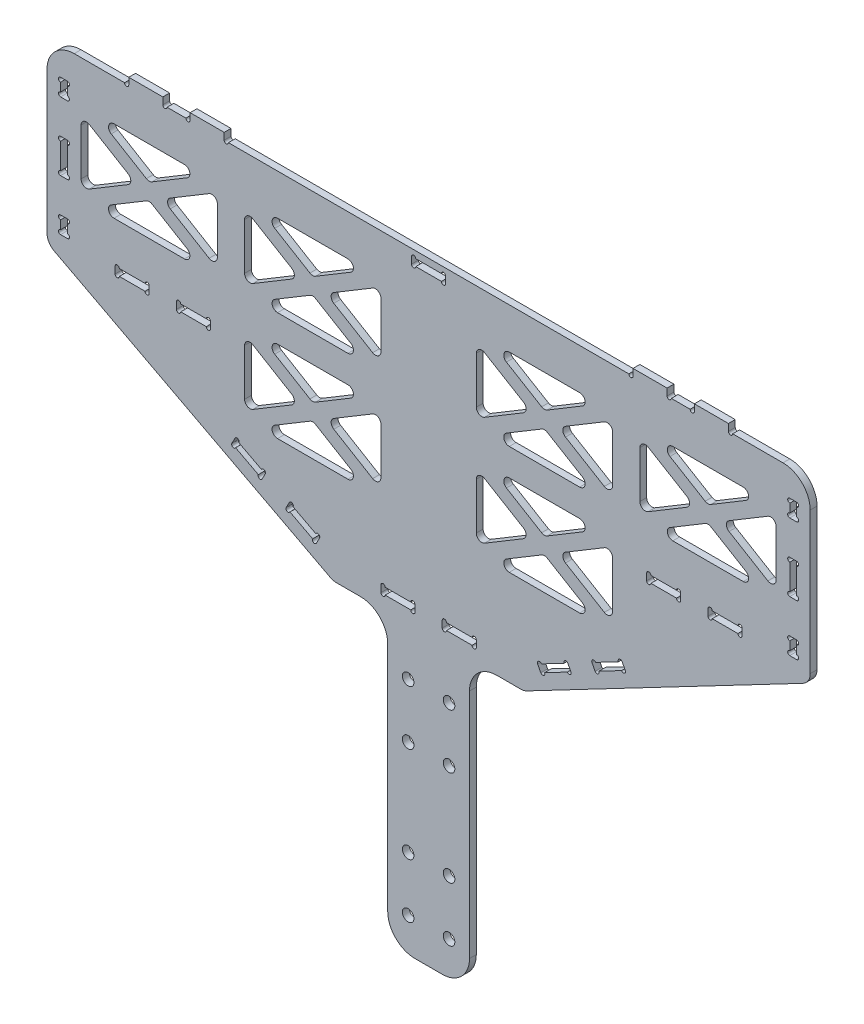
from build123d import *

# Parameters (mm, degrees)
EXTRUDE_1_DEPTH                = 5
SKETCH_2_R                     = 4.25
CUT_EXTRUDE_1_DEPTH            = 26
FILLET_1_R                     = 20
SKETCH_3_W                     = 80.881633881
SKETCH_3_H                     = 35.81900929
EXTRUDE_2_DEPTH                = 5
CUT_EXTRUDE_8_DEPTH            = 5
FILLET_3_R                     = 4
PATTERN_LINEAR_1_COUNT         = 2
PATTERN_LINEAR_1_PITCH         = 80
PATTERN_LINEAR_1_COUNT_DIR2    = 2
PATTERN_LINEAR_1_PITCH_DIR2    = 120
FILLET_3_OF_PATTERN_LINEAR_1_R = 4
MIRROR_1_DEPTH                 = 5
CUT_EXTRUDE_9_DEPTH            = 10
CUT_EXTRUDE_10_DEPTH           = 10
FILLET_4_R                     = 10
SKETCH_13_W                    = 25
SKETCH_13_H                    = 5
CUT_EXTRUDE_11_DEPTH           = 10
SKETCH_14_R                    = 1.55
CUT_EXTRUDE_12_DEPTH           = 10
SKETCH_15_W                    = 5
SKETCH_15_H                    = 12.5
SKETCH_15_H_2                  = 25
CUT_EXTRUDE_13_DEPTH           = 10
SKETCH_16_R                    = 1.55
CUT_EXTRUDE_14_DEPTH           = 10
CUT_EXTRUDE_15_DEPTH           = 10
SKETCH_18_W                    = 25
SKETCH_18_H                    = 5
EXTRUDE_3_DEPTH                = 5
SKETCH_19_R                    = 1.55
CUT_EXTRUDE_16_DEPTH           = 5


# Read off the part's stored shape, not the designer's step: 镜向1
with BuildPart() as part:
    # 草图1 → 凸台-拉伸1 (new body)
    with BuildSketch(Plane.XY):
        Polygon((-30, 0), (30, 0), (30, 210), (280, 210), (280, 450), (-280, 450), (-280, 210), (-30, 210), align=None)
    extrude(amount=EXTRUDE_1_DEPTH)

    # 草图2 → 切除-拉伸1 (cut)
    with BuildSketch(Plane.XY.offset(5)):
        with Locations((15, 25)):
            Circle(SKETCH_2_R)
        with Locations((15, 65)):
            Circle(SKETCH_2_R)
        with Locations((15, 135)):
            Circle(SKETCH_2_R)
        with Locations((15, 175)):
            Circle(SKETCH_2_R)
        with Locations(Location((-15, 175, 0), (0, 0, 180))):
            Circle(SKETCH_2_R)
        with Locations(Location((-15, 135, 0), (0, 0, 180))):
            Circle(SKETCH_2_R)
        with Locations(Location((-15, 65, 0), (0, 0, 180))):
            Circle(SKETCH_2_R)
        with Locations(Location((-15, 25, 0), (0, 0, 180))):
            Circle(SKETCH_2_R)
    extrude(amount=-CUT_EXTRUDE_1_DEPTH, mode=Mode.SUBTRACT)

    # 圆角1
    fillet_1_edges = [part.edges().sort_by_distance(p)[0] for p in [
        (30, 0, 2.5),
        (-30, 0, 2.5),
        (-30, 210, 2.5),
        (-280, 210, 2.5),
        (-280, 450, 2.5),
        (280, 450, 2.5),
        (280, 210, 2.5),
        (30, 210, 2.5),
    ]]
    fillet(fillet_1_edges, radius=FILLET_1_R)

    # 草图3 → 凸台-拉伸2 (add)
    with BuildSketch(Plane.XY.offset(5)):
        with Locations((-108.227329146, 265.055666303)):
            Rectangle(SKETCH_3_W, SKETCH_3_H)
    extrude(amount=-EXTRUDE_2_DEPTH)

    # 草图10 → 切除-拉伸8 (cut)
    with BuildSketch(Plane.XY.offset(5)):
        Polygon((-245.281746842, 420), (-164.718253158, 420), (-205, 395.830951895), align=None)
        Polygon((-255, 414.169048105), (-255, 365.830951895), (-214.718253158, 390), align=None)
        Polygon((-245.281746842, 360), (-164.718253158, 360), (-205, 384.169048105), align=None)
        Polygon((-155, 414.169048105), (-155, 365.830951895), (-195.281746842, 390), align=None)
    cut_extrude_8 = extrude(amount=-CUT_EXTRUDE_8_DEPTH, mode=Mode.SUBTRACT)

    # 圆角3
    fillet_3_edges = [part.edges().sort_by_distance(p)[0] for p in [
        (-164.718253158, 360, 2.5),
        (-205, 384.169048105, 2.5),
        (-245.281746842, 360, 2.5),
        (-255, 365.830951895, 2.5),
        (-214.718253158, 390, 2.5),
        (-255, 414.169048105, 2.5),
        (-155, 414.169048105, 2.5),
        (-195.281746842, 390, 2.5),
        (-155, 365.830951895, 2.5),
        (-164.718253158, 420, 2.5),
        (-245.281746842, 420, 2.5),
        (-205, 395.830951895, 2.5),
    ]]
    fillet(fillet_3_edges, radius=FILLET_3_R)

    # 阵列(线性)1: Cut-Extrude 8 2 × 2, 1 skipped
    with Locations(*[(j * PATTERN_LINEAR_1_PITCH_DIR2, -i * PATTERN_LINEAR_1_PITCH, 0) for i in range(PATTERN_LINEAR_1_COUNT) for j in range(PATTERN_LINEAR_1_COUNT_DIR2) if (i, j) not in ((0, 0), (1, 0))]):
        add(cut_extrude_8, mode=Mode.SUBTRACT)

    # 圆角3 of 阵列(线性)1
    fillet_3_of_pattern_linear_1_edges = [part.edges().sort_by_distance(p)[0] for p in [
        (-44.718253158, 360, 2.5),
        (-85, 384.169048105, 2.5),
        (-125.281746842, 360, 2.5),
        (-135, 365.830951895, 2.5),
        (-94.718253158, 390, 2.5),
        (-135, 414.169048105, 2.5),
        (-35, 414.169048105, 2.5),
        (-75.281746842, 390, 2.5),
        (-35, 365.830951895, 2.5),
        (-44.718253158, 420, 2.5),
        (-125.281746842, 420, 2.5),
        (-85, 395.830951895, 2.5),
        (-44.718253158, 280, 2.5),
        (-85, 304.169048105, 2.5),
        (-125.281746842, 280, 2.5),
        (-135, 285.830951895, 2.5),
        (-94.718253158, 310, 2.5),
        (-135, 334.169048105, 2.5),
        (-35, 334.169048105, 2.5),
        (-75.281746842, 310, 2.5),
        (-35, 285.830951895, 2.5),
        (-44.718253158, 340, 2.5),
        (-125.281746842, 340, 2.5),
        (-85, 315.830951895, 2.5),
    ]]
    fillet(fillet_3_of_pattern_linear_1_edges, radius=FILLET_3_OF_PATTERN_LINEAR_1_R)

    # 镜向1 outline → 镜向1 (cut)
    with BuildSketch(Plane.XY):
        with BuildLine():
            Line((59.159522351, 280), (110.840477649, 280))
            ThreePointArc((110.840477649, 280), (114.695337362, 282.932265672), (112.898460671, 287.429971703))
            Line((112.898460671, 287.429971703), (87.057983022, 302.934258292))
            ThreePointArc((87.057983022, 302.934258292), (85, 303.504286589), (82.942016978, 302.934258292))
            Line((82.942016978, 302.934258292), (57.101539329, 287.429971703))
            ThreePointArc((57.101539329, 287.429971703), (55.304662638, 282.932265672), (59.159522351, 280))
        make_face()
        with BuildLine():
            Line((110.840477649, 340), (59.159522351, 340))
            ThreePointArc((59.159522351, 340), (55.304662638, 337.067734328), (57.101539329, 332.570028297))
            Line((57.101539329, 332.570028297), (82.942016978, 317.065741708))
            ThreePointArc((82.942016978, 317.065741708), (85, 316.495713411), (87.057983022, 317.065741708))
            Line((87.057983022, 317.065741708), (112.898460671, 332.570028297))
            ThreePointArc((112.898460671, 332.570028297), (114.695337362, 337.067734328), (110.840477649, 340))
        make_face()
        with BuildLine():
            Line((230.840477649, 420), (179.159522351, 420))
            ThreePointArc((179.159522351, 420), (175.304662638, 417.067734328), (177.101539329, 412.570028297))
            Line((177.101539329, 412.570028297), (202.942016978, 397.065741708))
            ThreePointArc((202.942016978, 397.065741708), (205, 396.495713411), (207.057983022, 397.065741708))
            Line((207.057983022, 397.065741708), (232.898460671, 412.570028297))
            ThreePointArc((232.898460671, 412.570028297), (234.695337362, 417.067734328), (230.840477649, 420))
        make_face()
        with BuildLine():
            Line((110.840477649, 420), (59.159522351, 420))
            ThreePointArc((59.159522351, 420), (55.304662638, 417.067734328), (57.101539329, 412.570028297))
            Line((57.101539329, 412.570028297), (82.942016978, 397.065741708))
            ThreePointArc((82.942016978, 397.065741708), (85, 396.495713411), (87.057983022, 397.065741708))
            Line((87.057983022, 397.065741708), (112.898460671, 412.570028297))
            ThreePointArc((112.898460671, 412.570028297), (114.695337362, 417.067734328), (110.840477649, 420))
        make_face()
        with BuildLine():
            Line((179.159522351, 360), (230.840477649, 360))
            ThreePointArc((230.840477649, 360), (234.695337362, 362.932265672), (232.898460671, 367.429971703))
            Line((232.898460671, 367.429971703), (207.057983022, 382.934258292))
            ThreePointArc((207.057983022, 382.934258292), (205, 383.504286589), (202.942016978, 382.934258292))
            Line((202.942016978, 382.934258292), (177.101539329, 367.429971703))
            ThreePointArc((177.101539329, 367.429971703), (175.304662638, 362.932265672), (179.159522351, 360))
        make_face()
        with BuildLine():
            Line((59.159522351, 360), (110.840477649, 360))
            ThreePointArc((110.840477649, 360), (114.695337362, 362.932265672), (112.898460671, 367.429971703))
            Line((112.898460671, 367.429971703), (87.057983022, 382.934258292))
            ThreePointArc((87.057983022, 382.934258292), (85, 383.504286589), (82.942016978, 382.934258292))
            Line((82.942016978, 382.934258292), (57.101539329, 367.429971703))
            ThreePointArc((57.101539329, 367.429971703), (55.304662638, 362.932265672), (59.159522351, 360))
        make_face()
        with BuildLine():
            Line((161.057983022, 369.465741708), (189.565127337, 386.570028297))
            ThreePointArc((189.565127337, 386.570028297), (191.507144315, 390), (189.565127337, 393.429971703))
            Line((189.565127337, 393.429971703), (161.057983022, 410.534258292))
            ThreePointArc((161.057983022, 410.534258292), (157.02920474, 410.585086216), (155, 407.104286589))
            Line((155, 407.104286589), (155, 372.895713411))
            ThreePointArc((155, 372.895713411), (157.02920474, 369.414913784), (161.057983022, 369.465741708))
        make_face()
        with BuildLine():
            Line((220.434872663, 386.570028297), (248.942016978, 369.465741708))
            ThreePointArc((248.942016978, 369.465741708), (252.97079526, 369.414913784), (255, 372.895713411))
            Line((255, 372.895713411), (255, 407.104286589))
            ThreePointArc((255, 407.104286589), (252.97079526, 410.585086216), (248.942016978, 410.534258292))
            Line((248.942016978, 410.534258292), (220.434872663, 393.429971703))
            ThreePointArc((220.434872663, 393.429971703), (218.492855685, 390), (220.434872663, 386.570028297))
        make_face()
        with BuildLine():
            Line((69.565127337, 313.429971703), (41.057983022, 330.534258292))
            ThreePointArc((41.057983022, 330.534258292), (37.02920474, 330.585086216), (35, 327.104286589))
            Line((35, 327.104286589), (35, 292.895713411))
            ThreePointArc((35, 292.895713411), (37.02920474, 289.414913784), (41.057983022, 289.465741708))
            Line((41.057983022, 289.465741708), (69.565127337, 306.570028297))
            ThreePointArc((69.565127337, 306.570028297), (71.507144315, 310), (69.565127337, 313.429971703))
        make_face()
        with BuildLine():
            Line((128.942016978, 330.534258292), (100.434872663, 313.429971703))
            ThreePointArc((100.434872663, 313.429971703), (98.492855685, 310), (100.434872663, 306.570028297))
            Line((100.434872663, 306.570028297), (128.942016978, 289.465741708))
            ThreePointArc((128.942016978, 289.465741708), (132.97079526, 289.414913784), (135, 292.895713411))
            Line((135, 292.895713411), (135, 327.104286589))
            ThreePointArc((135, 327.104286589), (132.97079526, 330.585086216), (128.942016978, 330.534258292))
        make_face()
        with BuildLine():
            Line((135, 372.895713411), (135, 407.104286589))
            ThreePointArc((135, 407.104286589), (132.97079526, 410.585086216), (128.942016978, 410.534258292))
            Line((128.942016978, 410.534258292), (100.434872663, 393.429971703))
            ThreePointArc((100.434872663, 393.429971703), (98.492855685, 390), (100.434872663, 386.570028297))
            Line((100.434872663, 386.570028297), (128.942016978, 369.465741708))
            ThreePointArc((128.942016978, 369.465741708), (132.97079526, 369.414913784), (135, 372.895713411))
        make_face()
        with BuildLine():
            Line((35, 407.104286589), (35, 372.895713411))
            ThreePointArc((35, 372.895713411), (37.02920474, 369.414913784), (41.057983022, 369.465741708))
            Line((41.057983022, 369.465741708), (69.565127337, 386.570028297))
            ThreePointArc((69.565127337, 386.570028297), (71.507144315, 390), (69.565127337, 393.429971703))
            Line((69.565127337, 393.429971703), (41.057983022, 410.534258292))
            ThreePointArc((41.057983022, 410.534258292), (37.02920474, 410.585086216), (35, 407.104286589))
        make_face()
    extrude(amount=MIRROR_1_DEPTH, mode=Mode.SUBTRACT)

    # 草图11 → 切除-拉伸9 (cut)
    with BuildSketch(Plane.XY.offset(5)):
        with BuildLine():
            Line((-9.4, 445), (9.4, 445))
            ThreePointArc((9.4, 445), (10.95, 446.55), (12.5, 445))
            Line((12.5, 445), (12.5, 440))
            ThreePointArc((12.5, 440), (10.95, 438.45), (9.4, 440))
            Line((9.4, 440), (-9.4, 440))
            ThreePointArc((-9.4, 440), (-10.95, 438.45), (-12.5, 440))
            Line((-12.5, 440), (-12.5, 445))
            ThreePointArc((-12.5, 445), (-10.95, 446.55), (-9.4, 445))
        make_face()
    extrude(amount=-CUT_EXTRUDE_9_DEPTH, mode=Mode.SUBTRACT)

    # 草图12 → 切除-拉伸10 (cut)
    with BuildSketch(Plane.XY.offset(5)):
        with BuildLine():
            Line((-280, 320), (-70, 210))
            Line((-70, 210), (-260, 210))
            ThreePointArc((-260, 210), (-274.142135624, 215.857864376), (-280, 230))
            Line((-280, 230), (-280, 320))
        make_face()
        with BuildLine():
            Line((280, 320), (70, 210))
            Line((70, 210), (260, 210))
            ThreePointArc((260, 210), (274.142135624, 215.857864376), (280, 230))
            Line((280, 230), (280, 320))
        make_face()
    extrude(amount=-CUT_EXTRUDE_10_DEPTH, mode=Mode.SUBTRACT)

    # 圆角4
    fillet_4_edges = [part.edges().sort_by_distance(p)[0] for p in [
        (-280, 320, 2.5),
        (-70, 210, 2.5),
        (280, 320, 2.5),
        (70, 210, 2.5),
    ]]
    fillet(fillet_4_edges, radius=FILLET_4_R)

    # 草图13 → 切除-拉伸11 (cut)
    with BuildSketch(Plane.XY.offset(5)):
        with Locations((172.5, 327.5)):
            Rectangle(SKETCH_13_W, SKETCH_13_H)
        with Locations((217.5, 327.5)):
            Rectangle(SKETCH_13_W, SKETCH_13_H)
        with Locations((-217.5, 327.5)):
            Rectangle(SKETCH_13_W, SKETCH_13_H)
        with Locations((-172.5, 327.5)):
            Rectangle(SKETCH_13_W, SKETCH_13_H)
    extrude(amount=-CUT_EXTRUDE_11_DEPTH, mode=Mode.SUBTRACT)

    # 草图14 → 切除-拉伸12 (cut)
    with BuildSketch(Plane.XY.offset(5)):
        with Locations((228.45, 330)):
            Circle(SKETCH_14_R)
        with Locations((206.55, 330)):
            Circle(SKETCH_14_R)
        with Locations((206.55, 325)):
            Circle(SKETCH_14_R)
        with Locations((228.45, 325)):
            Circle(SKETCH_14_R)
        with Locations((183.45, 330)):
            Circle(SKETCH_14_R)
        with Locations((161.55, 330)):
            Circle(SKETCH_14_R)
        with Locations((183.45, 325)):
            Circle(SKETCH_14_R)
        with Locations((161.55, 325)):
            Circle(SKETCH_14_R)
        with Locations((-161.55, 325)):
            Circle(SKETCH_14_R)
        with Locations((-183.45, 325)):
            Circle(SKETCH_14_R)
        with Locations((-161.55, 330)):
            Circle(SKETCH_14_R)
        with Locations((-183.45, 330)):
            Circle(SKETCH_14_R)
        with Locations((-228.45, 325)):
            Circle(SKETCH_14_R)
        with Locations((-206.55, 325)):
            Circle(SKETCH_14_R)
        with Locations((-206.55, 330)):
            Circle(SKETCH_14_R)
        with Locations((-228.45, 330)):
            Circle(SKETCH_14_R)
    extrude(amount=-CUT_EXTRUDE_12_DEPTH, mode=Mode.SUBTRACT)

    # 草图15 → 切除-拉伸13 (cut)
    with BuildSketch(Plane.XY.offset(5)):
        with Locations((-267.5, 423.75)):
            Rectangle(SKETCH_15_W, SKETCH_15_H)
        with Locations((-267.5, 380)):
            Rectangle(SKETCH_15_W, SKETCH_15_H_2)
        with Locations((-267.5, 336.25)):
            Rectangle(SKETCH_15_W, SKETCH_15_H)
        with Locations((267.5, 336.25)):
            Rectangle(SKETCH_15_W, SKETCH_15_H)
        with Locations((267.5, 380)):
            Rectangle(SKETCH_15_W, SKETCH_15_H_2)
        with Locations((267.5, 423.75)):
            Rectangle(SKETCH_15_W, SKETCH_15_H)
    extrude(amount=-CUT_EXTRUDE_13_DEPTH, mode=Mode.SUBTRACT)

    # 草图16 → 切除-拉伸14 (cut)
    with BuildSketch(Plane.XY.offset(5)):
        with Locations((-265, 428.45)):
            Circle(SKETCH_16_R)
        with Locations((-265, 419.05)):
            Circle(SKETCH_16_R)
        with Locations((-270, 428.45)):
            Circle(SKETCH_16_R)
        with Locations((-270, 419.05)):
            Circle(SKETCH_16_R)
        with Locations((-265, 390.95)):
            Circle(SKETCH_16_R)
        with Locations((-265, 369.05)):
            Circle(SKETCH_16_R)
        with Locations((-270, 390.95)):
            Circle(SKETCH_16_R)
        with Locations((-270, 369.05)):
            Circle(SKETCH_16_R)
        with Locations((-265, 340.95)):
            Circle(SKETCH_16_R)
        with Locations((-265, 331.55)):
            Circle(SKETCH_16_R)
        with Locations((-270, 340.95)):
            Circle(SKETCH_16_R)
        with Locations((-270, 331.55)):
            Circle(SKETCH_16_R)
        with Locations((270, 331.55)):
            Circle(SKETCH_16_R)
        with Locations((270, 340.95)):
            Circle(SKETCH_16_R)
        with Locations((265, 331.55)):
            Circle(SKETCH_16_R)
        with Locations((265, 340.95)):
            Circle(SKETCH_16_R)
        with Locations((270, 369.05)):
            Circle(SKETCH_16_R)
        with Locations((270, 390.95)):
            Circle(SKETCH_16_R)
        with Locations((265, 369.05)):
            Circle(SKETCH_16_R)
        with Locations((265, 390.95)):
            Circle(SKETCH_16_R)
        with Locations((270, 419.05)):
            Circle(SKETCH_16_R)
        with Locations((270, 428.45)):
            Circle(SKETCH_16_R)
        with Locations((265, 419.05)):
            Circle(SKETCH_16_R)
        with Locations((265, 428.45)):
            Circle(SKETCH_16_R)
    extrude(amount=-CUT_EXTRUDE_14_DEPTH, mode=Mode.SUBTRACT)

    # 草图17 → 切除-拉伸15 (cut)
    with BuildSketch(Plane.XY.offset(5)):
        with BuildLine():
            Line((-142.00820747, 264.651827138), (-144.328242443, 260.222669462))
            ThreePointArc((-144.328242443, 260.222669462), (-143.674414405, 258.13041974), (-141.582164684, 258.784247778))
            Line((-141.582164684, 258.784247778), (-124.92853182, 250.060916278))
            ThreePointArc((-124.92853182, 250.060916278), (-124.274703782, 247.968666557), (-122.182454061, 248.622494595))
            Line((-122.182454061, 248.622494595), (-119.862419088, 253.051652271))
            ThreePointArc((-119.862419088, 253.051652271), (-120.516247126, 255.143901993), (-122.608496847, 254.490073955))
            Line((-122.608496847, 254.490073955), (-139.26212971, 263.213405455))
            ThreePointArc((-139.26212971, 263.213405455), (-139.915957748, 265.305655176), (-142.00820747, 264.651827138))
        make_face()
        with BuildLine():
            Line((-102.145788382, 243.771512378), (-104.465823355, 239.342354702))
            ThreePointArc((-104.465823355, 239.342354702), (-103.811995317, 237.25010498), (-101.719745596, 237.903933018))
            Line((-101.719745596, 237.903933018), (-85.066112733, 229.180601518))
            ThreePointArc((-85.066112733, 229.180601518), (-84.412284695, 227.088351797), (-82.320034973, 227.742179835))
            Line((-82.320034973, 227.742179835), (-80, 232.171337511))
            ThreePointArc((-80, 232.171337511), (-80.653828038, 234.263587233), (-82.746077759, 233.609759195))
            Line((-82.746077759, 233.609759195), (-99.399710623, 242.333090694))
            ThreePointArc((-99.399710623, 242.333090694), (-100.053538661, 244.425340416), (-102.145788382, 243.771512378))
        make_face()
        with BuildLine():
            Line((-35, 225), (-35, 220))
            ThreePointArc((-35, 220), (-33.45, 218.45), (-31.9, 220))
            Line((-31.9, 220), (-13.1, 220))
            ThreePointArc((-13.1, 220), (-11.55, 218.45), (-10, 220))
            Line((-10, 220), (-10, 225))
            ThreePointArc((-10, 225), (-11.55, 226.55), (-13.1, 225))
            Line((-13.1, 225), (-31.9, 225))
            ThreePointArc((-31.9, 225), (-33.45, 226.55), (-35, 225))
        make_face()
        with BuildLine():
            Line((13.1, 225), (31.9, 225))
            ThreePointArc((31.9, 225), (33.45, 226.55), (35, 225))
            Line((35, 225), (35, 220))
            ThreePointArc((35, 220), (33.45, 218.45), (31.9, 220))
            Line((31.9, 220), (13.1, 220))
            ThreePointArc((13.1, 220), (11.55, 218.45), (10, 220))
            Line((10, 220), (10, 225))
            ThreePointArc((10, 225), (11.55, 226.55), (13.1, 225))
        make_face()
        with BuildLine():
            Line((82.746077759, 233.609759195), (99.399710623, 242.333090694))
            ThreePointArc((99.399710623, 242.333090694), (100.053538661, 244.425340416), (102.145788382, 243.771512378))
            Line((102.145788382, 243.771512378), (104.465823355, 239.342354702))
            ThreePointArc((104.465823355, 239.342354702), (103.811995317, 237.25010498), (101.719745596, 237.903933018))
            Line((101.719745596, 237.903933018), (85.066112733, 229.180601518))
            ThreePointArc((85.066112733, 229.180601518), (84.412284695, 227.088351797), (82.320034973, 227.742179835))
            Line((82.320034973, 227.742179835), (80, 232.171337511))
            ThreePointArc((80, 232.171337511), (80.653828038, 234.263587233), (82.746077759, 233.609759195))
        make_face()
        with BuildLine():
            Line((122.608496847, 254.490073955), (139.26212971, 263.213405455))
            ThreePointArc((139.26212971, 263.213405455), (139.915957748, 265.305655176), (142.00820747, 264.651827138))
            Line((142.00820747, 264.651827138), (144.328242443, 260.222669462))
            ThreePointArc((144.328242443, 260.222669462), (143.674414405, 258.13041974), (141.582164684, 258.784247778))
            Line((141.582164684, 258.784247778), (124.92853182, 250.060916278))
            ThreePointArc((124.92853182, 250.060916278), (124.274703782, 247.968666557), (122.182454061, 248.622494595))
            Line((122.182454061, 248.622494595), (119.862419088, 253.051652271))
            ThreePointArc((119.862419088, 253.051652271), (120.516247126, 255.143901993), (122.608496847, 254.490073955))
        make_face()
    extrude(amount=-CUT_EXTRUDE_15_DEPTH, mode=Mode.SUBTRACT)

    # 草图18 → 凸台-拉伸3 (add)
    with BuildSketch(Plane.XY.offset(5)):
        with Locations((162.5, 452.5)):
            Rectangle(SKETCH_18_W, SKETCH_18_H)
        with Locations((-207.5, 452.5)):
            Rectangle(SKETCH_18_W, SKETCH_18_H)
        with Locations((207.5, 452.5)):
            Rectangle(SKETCH_18_W, SKETCH_18_H)
        with Locations((-162.5, 452.5)):
            Rectangle(SKETCH_18_W, SKETCH_18_H)
    extrude(amount=-EXTRUDE_3_DEPTH)

    # 草图19 → 切除-拉伸16 (cut)
    with BuildSketch(Plane.XY.offset(5)):
        with Locations((148.45, 450)):
            Circle(SKETCH_19_R)
        with Locations((176.55, 450)):
            Circle(SKETCH_19_R)
        with Locations((193.45, 450)):
            Circle(SKETCH_19_R)
        with Locations((221.55, 450)):
            Circle(SKETCH_19_R)
        with Locations((-221.55, 450)):
            Circle(SKETCH_19_R)
        with Locations((-193.45, 450)):
            Circle(SKETCH_19_R)
        with Locations((-176.55, 450)):
            Circle(SKETCH_19_R)
        with Locations((-148.45, 450)):
            Circle(SKETCH_19_R)
    extrude(amount=-CUT_EXTRUDE_16_DEPTH, mode=Mode.SUBTRACT)


solid = part.part
